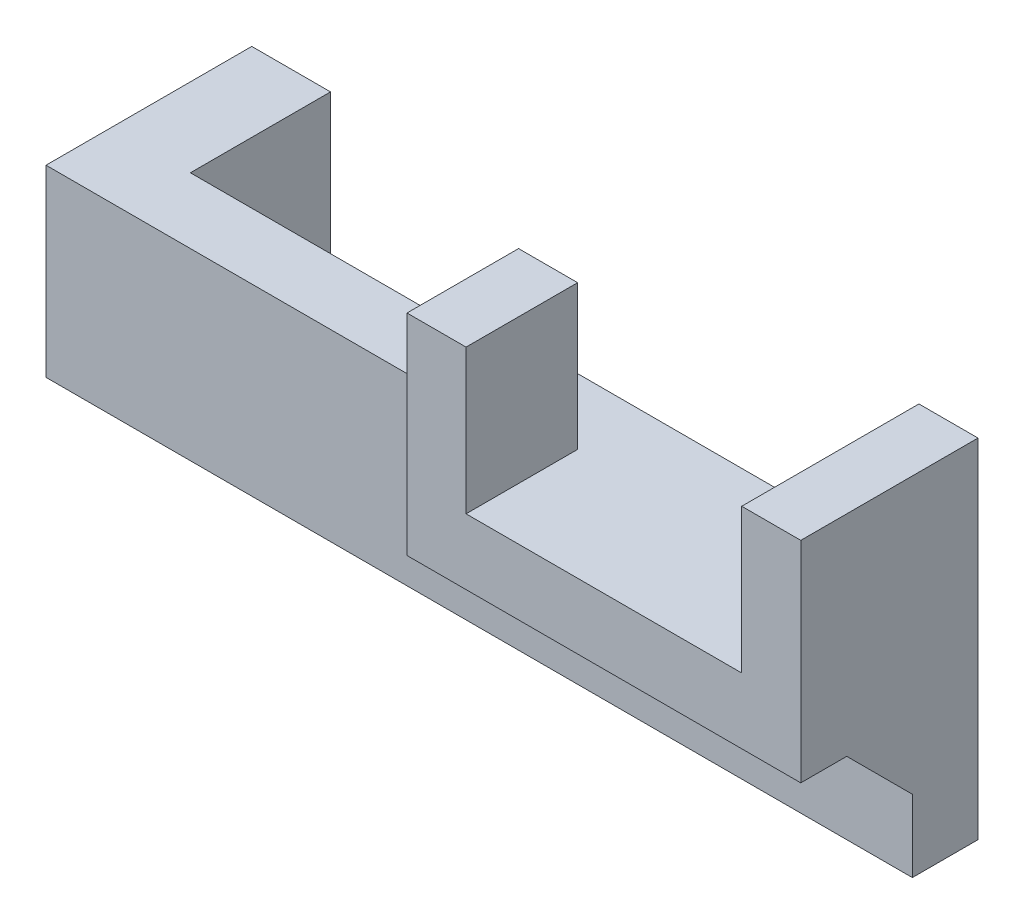
from build123d import *

# Parameters (mm, degrees)
SKETCH1_W           = 31.35
SKETCH1_H           = 28
BOSS_EXTRUDE1_DEPTH = 12
SKETCH2_W           = 10
SKETCH2_H           = 28
BOSS_EXTRUDE2_DEPTH = 120
SKETCH3_W           = 60
SKETCH3_H           = 25
BOSS_EXTRUDE3_DEPTH = 10
SKETCH4_W           = 42
SKETCH4_H           = 22
CUT_EXTRUDE1_DEPTH  = 146.656522339
BOSS_EXTRUDE4_DEPTH = 17
CHAMFER1_SIZE       = 10
SKETCH6_W           = 10
SKETCH6_H           = 22
CUT_EXTRUDE2_DEPTH  = 9
CHAMFER2_SIZE       = 10


with BuildPart() as part:
    # Sketch1 → Boss-Extrude1 (new body)
    with BuildSketch(Plane(origin=(0, 0, 0), x_dir=(0, 0, -1), z_dir=(1, 0, 0))):
        with Locations((15.675, 14)):
            Rectangle(SKETCH1_W, SKETCH1_H)
    extrude(amount=BOSS_EXTRUDE1_DEPTH)

    # Sketch2 → Boss-Extrude2 (add)
    with BuildSketch(Plane(origin=(12, 0, 0), x_dir=(0, 0, -1), z_dir=(1, 0, 0))):
        with Locations((5, 14)):
            Rectangle(SKETCH2_W, SKETCH2_H)
    extrude(amount=BOSS_EXTRUDE2_DEPTH)

    # Sketch3 → Boss-Extrude3 (add)
    with BuildSketch(Plane.XY):
        with Locations((102, 40.5)):
            Rectangle(SKETCH3_W, SKETCH3_H)
    extrude(amount=-BOSS_EXTRUDE3_DEPTH)

    # Sketch4 → Cut-Extrude1 (cut, through all)
    with BuildSketch(Plane.XY):
        with Locations((102, 42)):
            Rectangle(SKETCH4_W, SKETCH4_H)
    extrude(amount=-CUT_EXTRUDE1_DEPTH, mode=Mode.SUBTRACT)

    # Sketch5 → Boss-Extrude4 (add)
    with BuildSketch(Plane.XY):
        Polygon((81, 31), (81, 53), (72, 53), (72, 28), (72, 21), (132, 21), (132, 53), (123, 53), (123, 31), align=None)
    extrude(amount=BOSS_EXTRUDE4_DEPTH)

    # Chamfer1
    chamfer1_edges = [part.edges().sort_by_distance(p)[0] for p in [
        (72, 24.5, 0),
        (102, 21, 0),
    ]]
    chamfer(chamfer1_edges, length=CHAMFER1_SIZE)

    # Sketch6 → Cut-Extrude2 (cut)
    with BuildSketch(Plane.ZY.offset(-72)):
        with Locations((-5, 42)):
            Rectangle(SKETCH6_W, SKETCH6_H)
    extrude(amount=-CUT_EXTRUDE2_DEPTH, mode=Mode.SUBTRACT)

    # Chamfer2
    chamfer2_edges = [part.edges().sort_by_distance(p)[0] for p in [
        (72, 28, 0),
    ]]
    chamfer(chamfer2_edges, length=CHAMFER2_SIZE - 0.0001)  # a hair under: the kernel refuses the full size


solid = part.part
